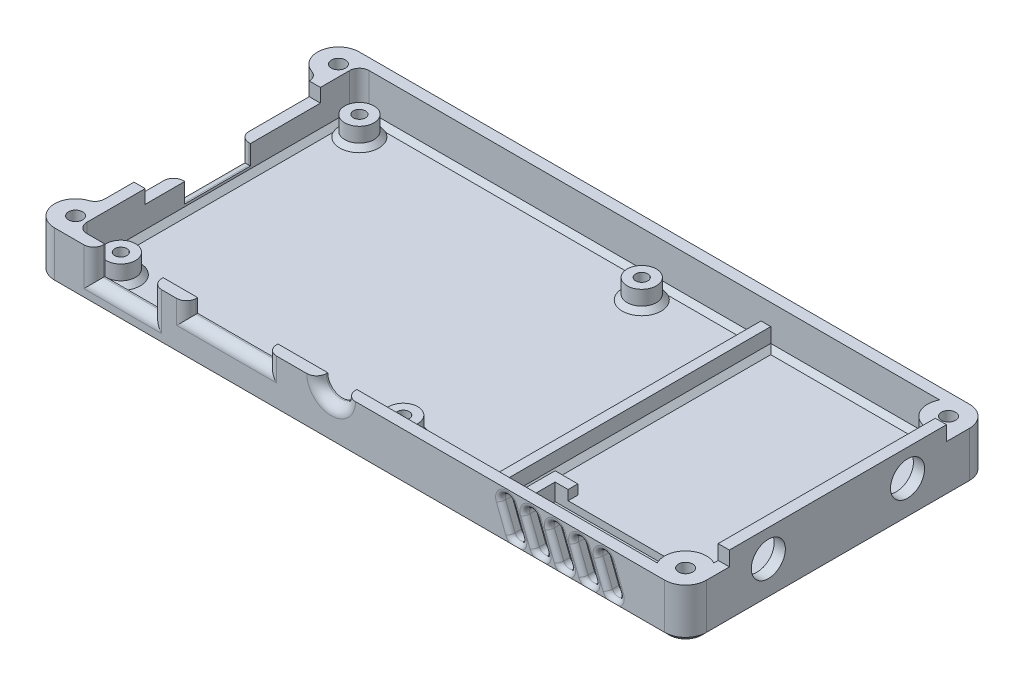
from build123d import *

# Parameters (mm, degrees)
SKETCH3_W                      = 129.6
SKETCH3_H                      = 62.6
SKETCH3_W_2                    = 125
SKETCH3_H_2                    = 58
BOSS_EXTRUDE1_DEPTH            = 10.3
SKETCH5_W                      = 125
SKETCH5_H                      = 58
BOSS_EXTRUDE2_DEPTH            = 2
SKETCH6_R                      = 3
BOSS_EXTRUDE3_DEPTH            = 4
F_2_5_2_5_DIAMETER_HOLE1_D     = 2.5
F_2_5_2_5_DIAMETER_HOLE1_DEPTH = 8
F_2_5_2_5_DIAMETER_HOLE1_TIP   = 0.751075774
SKETCH10_W                     = 2
SKETCH10_H                     = 58
BOSS_EXTRUDE4_DEPTH            = 4
CUT_EXTRUDE1_REACH             = 100.128
SKETCH11_R                     = 3
SKETCH11_W                     = 12
SKETCH11_H                     = 5.8
SKETCH11_W_2                   = 16.5
SKETCH11_H_2                   = 2.8
CUT_EXTRUDE2_REACH             = 136.484
SKETCH12_W                     = 13.5
SKETCH12_H                     = 6.8
SKETCH12_W_2                   = 36
SKETCH12_H_2                   = 2.8
FILLET6_R                      = 2
FILLET8_R                      = 2
CHAMFER1_SIZE                  = 1
FILLET9_R                      = 2
BOSS_EXTRUDE6_DEPTH            = 10.3
F_2_9_2_9_DIAMETER_HOLE2_D     = 2.9
F_2_9_2_9_DIAMETER_HOLE1_D     = 2.9
SKETCH24_R                     = 4.3
BOSS_EXTRUDE7_DEPTH            = 8.3
F_2_9_2_9_DIAMETER_HOLE5_D     = 2.9
F_2_9_2_9_DIAMETER_HOLE4_D     = 2.9
FILLET10_R                     = 4.3
FILLET18_R                     = 2
CHAMFER3_SIZE                  = 1
FILLET19_R                     = 2
FILLET20_R                     = 4.3
CHAMFER6_SIZE                  = 1
SKETCH29_W                     = 2.3
SKETCH29_H                     = 44.6
BOSS_EXTRUDE8_DEPTH            = 3
CUT_EXTRUDE3_REACH             = 163.516
SKETCH13_R                     = 3.5
SKETCH32_W                     = 30.1
SKETCH32_H                     = 10.2
CUT_EXTRUDE4_DEPTH             = 1.5
BOSS_EXTRUDE9_DEPTH            = 2
CUT_EXTRUDE5_REACH             = 103.795
FILLET21_R                     = 1
CHAMFER7_SIZE                  = 1


# Some blends are built 0.0001 mm under size
with BuildPart() as part:
    # Sketch3 → Boss-Extrude1 (new body)
    with BuildSketch(Plane(origin=(0, 0, 0), x_dir=(1, 0, 0), z_dir=(0, 1, 0))):
        with Locations((-10.061766162, 3.105993834)):
            Rectangle(SKETCH3_W, SKETCH3_H)
        with Locations((-10.061766162, 3.105993834)):
            Rectangle(SKETCH3_W_2, SKETCH3_H_2, mode=Mode.SUBTRACT)
    extrude(amount=BOSS_EXTRUDE1_DEPTH)

    # Sketch5 → Boss-Extrude2 (add)
    with BuildSketch(Plane(origin=(0, 0, 0), x_dir=(1, 0, 0), z_dir=(0, 1, 0))):
        with Locations((-10.061766162, 3.105993834)):
            Rectangle(SKETCH5_W, SKETCH5_H)
    extrude(amount=BOSS_EXTRUDE2_DEPTH)

    # Sketch6 → Boss-Extrude3 (add)
    with BuildSketch(Plane(origin=(0, 2, 0), x_dir=(1, 0, 0), z_dir=(0, 1, 0))):
        with Locations(Location((-68.061766162, 27.605993834, 0), (0, 0, 270))):
            Circle(SKETCH6_R)
        with Locations(Location((-68.061766162, -21.394006166, 0), (0, 0, 270))):
            Circle(SKETCH6_R)
        with Locations(Location((-10.061766162, -21.394006166, 0), (0, 0, 270))):
            Circle(SKETCH6_R)
        with Locations(Location((-10.061766162, 27.605993834, 0), (0, 0, 270))):
            Circle(SKETCH6_R)
    extrude(amount=BOSS_EXTRUDE3_DEPTH)

    # Ø2.5 (2.5) Diameter Hole1
    with Locations(Plane(origin=(0, 6, 0), x_dir=(1, 0, 0), z_dir=(0, 1, 0))):
        with Locations((-68.061766162, 27.605993834), (-10.061766162, 27.605993834), (-10.061766162, -21.394006166), (-68.061766162, -21.394006166)):
            Hole(F_2_5_2_5_DIAMETER_HOLE1_D / 2, depth=F_2_5_2_5_DIAMETER_HOLE1_DEPTH)
            with Locations((0, 0, -(F_2_5_2_5_DIAMETER_HOLE1_DEPTH + F_2_5_2_5_DIAMETER_HOLE1_TIP / 2))):  # 118° drill point
                Cone(0, F_2_5_2_5_DIAMETER_HOLE1_D / 2, F_2_5_2_5_DIAMETER_HOLE1_TIP, mode=Mode.SUBTRACT)

    # Sketch10 → Boss-Extrude4 (add)
    with BuildSketch(Plane(origin=(0, 2, 0), x_dir=(1, 0, 0), z_dir=(0, 1, 0))):
        with Locations((10.938233838, 3.105993834)):
            Rectangle(SKETCH10_W, SKETCH10_H)
    extrude(amount=BOSS_EXTRUDE4_DEPTH)

    # Sketch11 → Cut-Extrude1 (cut, up to next)
    with BuildSketch(Plane.XY.offset(28.194006166), mode=Mode.PRIVATE) as cut_extrude1_sk1:
        with Locations((-18.061766162, 10.3)):
            Circle(SKETCH11_R)
    cut_extrude1_tool1 = extrude(cut_extrude1_sk1.sketch, amount=-CUT_EXTRUDE1_REACH, mode=Mode.PRIVATE) & part.part
    # Sketch11 → Cut-Extrude1 (cut, up to next)
    with BuildSketch(Plane.XY.offset(28.194006166), mode=Mode.PRIVATE) as cut_extrude1_sk2:
        with Locations((-60.861766162, 7.4)):
            Rectangle(SKETCH11_W, SKETCH11_H)
    cut_extrude1_tool2 = extrude(cut_extrude1_sk2.sketch, amount=-CUT_EXTRUDE1_REACH, mode=Mode.PRIVATE) & part.part
    # Sketch11 → Cut-Extrude1 (cut, up to next)
    with BuildSketch(Plane.XY.offset(28.194006166), mode=Mode.PRIVATE) as cut_extrude1_sk3:
        with Locations((-39.527982648, 8.9)):
            Rectangle(SKETCH11_W_2, SKETCH11_H_2)
    cut_extrude1_tool3 = extrude(cut_extrude1_sk3.sketch, amount=-CUT_EXTRUDE1_REACH, mode=Mode.PRIVATE) & part.part
    add(cut_extrude1_tool1.solids().sort_by_distance((-18.061766, 10.3, 28.194006))[0], mode=Mode.SUBTRACT)
    add(cut_extrude1_tool2.solids().sort_by_distance((-60.861766, 7.4, 28.194006))[0], mode=Mode.SUBTRACT)
    add(cut_extrude1_tool3.solids().sort_by_distance((-39.527983, 8.9, 28.194006))[0], mode=Mode.SUBTRACT)

    # Sketch12 → Cut-Extrude2 (cut, up to next)
    with BuildSketch(Plane.ZY.offset(74.861766162), mode=Mode.PRIVATE) as cut_extrude2_sk1:
        with Locations((-2.982922372, 6.9)):
            Rectangle(SKETCH12_W, SKETCH12_H)
    cut_extrude2_tool1 = extrude(cut_extrude2_sk1.sketch, amount=-CUT_EXTRUDE2_REACH, mode=Mode.PRIVATE) & part.part
    # Sketch12 → Cut-Extrude2 (cut, up to next)
    with BuildSketch(Plane.ZY.offset(74.861766162), mode=Mode.PRIVATE) as cut_extrude2_sk2:
        with Locations((-6.105993834, 8.9)):
            Rectangle(SKETCH12_W_2, SKETCH12_H_2)
    cut_extrude2_tool2 = extrude(cut_extrude2_sk2.sketch, amount=-CUT_EXTRUDE2_REACH, mode=Mode.PRIVATE) & part.part
    add(cut_extrude2_tool1.solids().sort_by_distance((-74.861766, 6.9, -2.982922))[0], mode=Mode.SUBTRACT)
    add(cut_extrude2_tool2.solids().sort_by_distance((-74.861766, 8.9, -6.105994))[0], mode=Mode.SUBTRACT)

    # Fillet6
    fillet6_edges = [part.edges().sort_by_distance(p)[0] for p in [
        (52.438233838, 6.15, -32.105993834),
    ]]
    fillet(fillet6_edges, radius=FILLET6_R)

    # Fillet8
    fillet8_edges = [part.edges().sort_by_distance(p)[0] for p in [
        (-72.561766162, 6.15, -32.105993834),
        (-72.561766162, 6.15, 25.894006166),
    ]]
    fillet(fillet8_edges, radius=FILLET8_R)

    # Chamfer1
    chamfer1_edges = [part.edges().sort_by_distance(p)[0] for p in [
        (-68.061766162, 2, -30.605993834),
        (-68.061766162, 2, 18.394006166),
        (-10.061766162, 2, 18.394006166),
        (-10.061766162, 2, -30.605993834),
    ]]
    chamfer(chamfer1_edges, length=CHAMFER1_SIZE)

    # Fillet9
    fillet9_edges = [part.edges().sort_by_distance(p)[0] for p in [
        (-60.861766162, 4.5, 28.194006166),
        (-54.861766162, 7.4, 28.194006166),
        (-47.777982648, 8.9, 28.194006166),
        (-39.527982648, 7.5, 28.194006166),
        (-31.277982648, 8.9, 28.194006166),
        (-18.061766162, 7.3, 28.194006166),
        (-74.861766162, 5.5, -9.732922372),
        (-74.861766162, 3.5, -2.982922372),
        (-74.861766162, 5.5, 3.767077628),
    ]]
    fillet(fillet9_edges, radius=FILLET9_R)

    # Sketch17 → Boss-Extrude6 (add)
    with BuildSketch(Plane(origin=(0, 0, 0), x_dir=(1, 0, 0), z_dir=(0, 1, 0))):
        with BuildLine():
            Line((-74.861766162, 34.405993834), (-74.861766162, 25.805993834))
            ThreePointArc((-74.861766162, 25.805993834), (-79.161766162, 30.105993834), (-74.861766162, 34.405993834))
        make_face()
        with BuildLine():
            Line((-74.861766162, -19.594006166), (-74.861766162, -28.194006166))
            ThreePointArc((-74.861766162, -28.194006166), (-79.161766162, -23.894006166), (-74.861766162, -19.594006166))
        make_face()
    extrude(amount=BOSS_EXTRUDE6_DEPTH)

    # Ø2.9 (2.9) Diameter Hole2 (through all)
    with Locations(Plane(origin=(0, 10.3, 0), x_dir=(1, 0, 0), z_dir=(0, 1, 0))):
        with Locations((-74.861766162, 30.105993834)):
            Hole(F_2_9_2_9_DIAMETER_HOLE2_D / 2)

    # Ø2.9 (2.9) Diameter Hole1 (through all)
    with Locations(Plane(origin=(0, 10.3, 0), x_dir=(1, 0, 0), z_dir=(0, 1, 0))):
        with Locations((-74.861766162, -23.894006166)):
            Hole(F_2_9_2_9_DIAMETER_HOLE1_D / 2)

    # Sketch24 → Boss-Extrude7 (add)
    with BuildSketch(Plane(origin=(0, 2, 0), x_dir=(1, 0, 0), z_dir=(0, 1, 0))):
        with Locations((50.438233838, -23.894006166)):
            Circle(SKETCH24_R)
        with Locations((50.438233838, 30.105993834)):
            Circle(SKETCH24_R)
    extrude(amount=BOSS_EXTRUDE7_DEPTH)

    # Ø2.9 (2.9) Diameter Hole5 (through all)
    with Locations(Plane(origin=(0, 10.3, 0), x_dir=(1, 0, 0), z_dir=(0, 1, 0))):
        with Locations((50.438233838, -23.894006166)):
            Hole(F_2_9_2_9_DIAMETER_HOLE5_D / 2)

    # Ø2.9 (2.9) Diameter Hole4 (through all)
    with Locations(Plane(origin=(0, 10.3, 0), x_dir=(1, 0, 0), z_dir=(0, 1, 0))):
        with Locations((50.438233838, 30.105993834)):
            Hole(F_2_9_2_9_DIAMETER_HOLE4_D / 2)

    # Fillet10
    fillet10_edges = [part.edges().sort_by_distance(p)[0] for p in [
        (54.738233838, 5.15, -34.405993834),
    ]]
    fillet(fillet10_edges, radius=FILLET10_R - 0.0001)  # a hair under: the kernel refuses the full size

    # Fillet18
    fillet18_edges = [part.edges().sort_by_distance(p)[0] for p in [
        (-74.861766162, 5.15, -25.805993834),
        (-74.861766162, 5.15, 19.594006166),
    ]]
    fillet(fillet18_edges, radius=FILLET18_R)

    # Chamfer3
    chamfer3_edges = [part.edges().sort_by_distance(p)[0] for p in [
        (-79.105793795, 0, -30.797535193),
        (-12.211716162, 0, -34.405993834),
        (53.478822286, 0, -33.146582283),
        (-79.105793795, 0, 24.585547524),
        (-74.861766162, 0, -3.105993834),
        (-75.2385223, 0, 19.088261462),
        (-75.2385223, 0, -25.300249131),
        (54.738233838, 0, -0.956043834),
        (-10.061766162, 0, 28.194006166),
    ]]
    chamfer(chamfer3_edges, length=CHAMFER3_SIZE)

    # Fillet19
    fillet19_edges = [part.edges().sort_by_distance(p)[0] for p in [
        (-66.861766162, 6.4, 28.194006166),
    ]]
    fillet(fillet19_edges, radius=FILLET19_R)

    # Fillet20
    # the kernel refuses this fillet: 4.3 mm, written as the material it takes off along each edge
    with BuildSketch(Plane(origin=(54.738233838, -9.75, 28.194006166), x_dir=(-1, 0, 0), z_dir=(0, 1, 0))) as fillet20_piece_1:
        with BuildLine():
            CenterArc((FILLET20_R, -FILLET20_R), FILLET20_R, 90, 90)
            Line((0, -FILLET20_R), (0, 0))
            Line((0, 0), (FILLET20_R, 0))
        make_face()
    extrude(amount=30.8, mode=Mode.SUBTRACT)

    # Chamfer5
    # the kernel refuses this chamfer: 1 mm, written as the material it adds along each edge
    with BuildSketch(Plane(origin=(-72.561766162, 2, 23.894006166), x_dir=(-0.027495876610568366, 0.9996219169112972, 0), z_dir=(0, 0, -1))) as chamfer5_piece_1:
        with BuildLine():
            Line((1.028673195, 0), (-0.056547155, 1.027117794))
            Line((-0.056547155, 1.027117794), (-0.076539593, 1.026567876))
            ThreePointArc((-0.076539593, 1.026567876), (-0.034129227, 0.51339783), (-0.019992438, -0.000549918))
            Line((-0.019992438, -0.000549918), (0.000549918, -0.019992438))
            ThreePointArc((0.000549918, -0.019992438), (0.514497665, -0.00585565), (1.029223113, -0.019992438))
            Line((1.029223113, -0.019992438), (1.028673195, 0))
        make_face()
    extrude(amount=54)
    with BuildSketch(Plane(origin=(-70.561766162, 2, 23.894006166), x_dir=(0, 0, 1), z_dir=(1, 0, 0))) as chamfer5_piece_2:
        with BuildLine():
            Line((0.971715729, 0.028284271), (2.028284271, -1.028284271))
            Line((2.028284271, -1.028284271), (2.048284271, -1.028284271))
            ThreePointArc((2.048284271, -1.028284271), (2.02, -0.514142136), (2.02, 0))
            Line((2.02, 0), (2, 0.02))
            ThreePointArc((2, 0.02), (1.485857864, 0.02), (0.971715729, 0.048284271))
            Line((0.971715729, 0.048284271), (0.971715729, 0.028284271))
        make_face()
    revolve(axis=Axis((-70.561766162, 2, 23.894006166), (0, -1, 0)), revolution_arc=90)
    with BuildSketch(Plane(origin=(-70.561766162, 2, -30.105993834), x_dir=(0, 0, -1), z_dir=(1, 0, 0))) as chamfer5_piece_3:
        with BuildLine():
            Line((2.028284271, 1.028284271), (0.971715729, -0.028284271))
            Line((0.971715729, -0.028284271), (0.971715729, -0.048284271))
            ThreePointArc((0.971715729, -0.048284271), (1.485857864, -0.02), (2, -0.02))
            Line((2, -0.02), (2.02, 0))
            ThreePointArc((2.02, 0), (2.02, 0.514142136), (2.048284271, 1.028284271))
            Line((2.048284271, 1.028284271), (2.028284271, 1.028284271))
        make_face()
    revolve(axis=Axis((-70.561766162, 2, -30.105993834), (0, 1, 0)), revolution_arc=90)
    with BuildSketch(Plane(origin=(9.938233838, 2, 25.894006166), x_dir=(0, 0.9996219169112968, 0.027495876610585623), z_dir=(-1, 0, 0)), Plane(origin=(-70.561766162, 2, -32.105993834), x_dir=(0, 0.9996219169112968, -0.027495876610589075), z_dir=(1, 0, 0))) as chamfer5_piece_4:
        with BuildLine():
            Line((1.028673195, 0), (-0.056547155, 1.027117794))
            Line((-0.056547155, 1.027117794), (-0.076539593, 1.026567876))
            ThreePointArc((-0.076539593, 1.026567876), (-0.034129227, 0.51339783), (-0.019992438, -0.000549918))
            Line((-0.019992438, -0.000549918), (0.000549918, -0.019992438))
            ThreePointArc((0.000549918, -0.019992438), (0.514497665, -0.00585565), (1.029223113, -0.019992438))
            Line((1.029223113, -0.019992438), (1.028673195, 0))
        make_face()
    extrude(amount=80.5)
    with BuildSketch(Plane(origin=(9.938233838, 2, 25.894006166), x_dir=(0.027495876610585623, 0.9996219169112968, 0), z_dir=(0, 0, -1)), Plane(origin=(11.938233838, 2, -32.105993834), x_dir=(-0.027495876610585623, 0.9996219169112968, 0), z_dir=(0, 0, 1))) as chamfer5_piece_5:
        with BuildLine():
            Line((1.028673195, 0), (-0.056547155, -1.027117794))
            Line((-0.056547155, -1.027117794), (-0.076539593, -1.026567876))
            ThreePointArc((-0.076539593, -1.026567876), (-0.034129227, -0.51339783), (-0.019992438, 0.000549918))
            Line((-0.019992438, 0.000549918), (0.000549918, 0.019992438))
            ThreePointArc((0.000549918, 0.019992438), (0.514497665, 0.00585565), (1.029223113, 0.019992438))
            Line((1.029223113, 0.019992438), (1.028673195, 0))
        make_face()
    extrude(amount=58)
    with BuildSketch(Plane(origin=(11.938233838, 2, -32.105993834), x_dir=(0, 0.9996219169112968, -0.027495876610589075), z_dir=(1, 0, 0))) as chamfer5_piece_6_section:
        with BuildLine():
            Line((1.028673195, 0), (-0.056547155, 1.027117794))
            Line((-0.056547155, 1.027117794), (-0.076539593, 1.026567876))
            ThreePointArc((-0.076539593, 1.026567876), (-0.034129227, 0.51339783), (-0.019992438, -0.000549918))
            Line((-0.019992438, -0.000549918), (0.000549918, -0.019992438))
            ThreePointArc((0.000549918, -0.019992438), (0.514497665, -0.00585565), (1.029223113, -0.019992438))
            Line((1.029223113, -0.019992438), (1.028673195, 0))
        make_face()
    chamfer5_piece_6 = extrude(amount=37.265109726, mode=Mode.PRIVATE)
    chamfer5_piece_6 = chamfer5_piece_6 - Plane(origin=(50.438233838, 2.330190731, -30.105993834), x_dir=(1, 0, 0), z_dir=(0, -1, 0)) * Cylinder(4.3, 79, mode=Mode.PRIVATE)
    add(chamfer5_piece_6)
    with BuildSketch(Plane(origin=(9.938233838, 2, 28.465689154), x_dir=(0.027495876610585623, 0.9996219169112968, 0), z_dir=(0, 0, -1))) as chamfer5_piece_7a_section:
        with BuildLine():
            Line((1.028673195, 0), (-0.056547155, -1.027117794))
            Line((-0.056547155, -1.027117794), (-0.076539593, -1.026567876))
            ThreePointArc((-0.076539593, -1.026567876), (-0.034129227, -0.51339783), (-0.019992438, 0.000549918))
            Line((-0.019992438, 0.000549918), (0.000549918, 0.019992438))
            ThreePointArc((0.000549918, 0.019992438), (0.514497665, 0.00585565), (1.029223113, 0.019992438))
            Line((1.029223113, 0.019992438), (1.028673195, 0))
        make_face()
    chamfer5_piece_7a = extrude(amount=60.571682988, mode=Mode.PRIVATE)
    chamfer5_piece_7a = split(chamfer5_piece_7a, bisect_by=Plane(origin=(9.608440211, 2.329793627, 25.894006166), z_dir=(0, 0, 1)), keep=Keep.TOP, mode=Mode.PRIVATE)
    with BuildSketch(Plane(origin=(12.509916826, 2, 25.894006166), x_dir=(0, 0.9996219169112968, 0.027495876610585623), z_dir=(-1, 0, 0))) as chamfer5_piece_7b_section:
        with BuildLine():
            Line((1.028673195, 0), (-0.056547155, 1.027117794))
            Line((-0.056547155, 1.027117794), (-0.076539593, 1.026567876))
            ThreePointArc((-0.076539593, 1.026567876), (-0.034129227, 0.51339783), (-0.019992438, -0.000549918))
            Line((-0.019992438, -0.000549918), (0.000549918, -0.019992438))
            ThreePointArc((0.000549918, -0.019992438), (0.514497665, -0.00585565), (1.029223113, -0.019992438))
            Line((1.029223113, -0.019992438), (1.028673195, 0))
        make_face()
    chamfer5_piece_7b = extrude(amount=83.071682988, mode=Mode.PRIVATE)
    chamfer5_piece_7b = split(chamfer5_piece_7b, bisect_by=Plane(origin=(9.938233838, 2.329793627, 25.564212539), z_dir=(1, 0, 0)), keep=Keep.TOP, mode=Mode.PRIVATE)
    chamfer5_piece_7 = chamfer5_piece_7a & chamfer5_piece_7b
    add(chamfer5_piece_7)
    with BuildSketch(Plane(origin=(-70.561766162, 2, -32.105993834), x_dir=(0, 0.9996219169112968, -0.027495876610589075), z_dir=(1, 0, 0))) as chamfer5_piece_8a_section:
        with BuildLine():
            Line((1.028673195, 0), (-0.056547155, 1.027117794))
            Line((-0.056547155, 1.027117794), (-0.076539593, 1.026567876))
            ThreePointArc((-0.076539593, 1.026567876), (-0.034129227, 0.51339783), (-0.019992438, -0.000549918))
            Line((-0.019992438, -0.000549918), (0.000549918, -0.019992438))
            ThreePointArc((0.000549918, -0.019992438), (0.514497665, -0.00585565), (1.029223113, -0.019992438))
            Line((1.029223113, -0.019992438), (1.028673195, 0))
        make_face()
    chamfer5_piece_8a = extrude(amount=83.071682988, mode=Mode.PRIVATE)
    chamfer5_piece_8a = split(chamfer5_piece_8a, bisect_by=Plane(origin=(9.938233838, 2.329793627, -31.776200208), z_dir=(1, 0, 0)), keep=Keep.TOP, mode=Mode.PRIVATE)
    with BuildSketch(Plane(origin=(9.938233838, 2, 25.894006166), x_dir=(0.027495876610585623, 0.9996219169112968, 0), z_dir=(0, 0, -1))) as chamfer5_piece_8b_section:
        with BuildLine():
            Line((1.028673195, 0), (-0.056547155, -1.027117794))
            Line((-0.056547155, -1.027117794), (-0.076539593, -1.026567876))
            ThreePointArc((-0.076539593, -1.026567876), (-0.034129227, -0.51339783), (-0.019992438, 0.000549918))
            Line((-0.019992438, 0.000549918), (0.000549918, 0.019992438))
            ThreePointArc((0.000549918, 0.019992438), (0.514497665, 0.00585565), (1.029223113, 0.019992438))
            Line((1.029223113, 0.019992438), (1.028673195, 0))
        make_face()
    chamfer5_piece_8b = extrude(amount=60.571682988, mode=Mode.PRIVATE)
    chamfer5_piece_8b = split(chamfer5_piece_8b, bisect_by=Plane(origin=(9.608440211, 2.329793627, -32.105993834), z_dir=(0, 0, -1)), keep=Keep.TOP, mode=Mode.PRIVATE)
    chamfer5_piece_8 = chamfer5_piece_8a & chamfer5_piece_8b
    add(chamfer5_piece_8)
    with BuildSketch(Plane(origin=(9.36655085, 2, -32.105993834), x_dir=(0, 0.9996219169112968, -0.027495876610589075), z_dir=(1, 0, 0))) as chamfer5_piece_9a_section:
        with BuildLine():
            Line((1.028673195, 0), (-0.056547155, 1.027117794))
            Line((-0.056547155, 1.027117794), (-0.076539593, 1.026567876))
            ThreePointArc((-0.076539593, 1.026567876), (-0.034129227, 0.51339783), (-0.019992438, -0.000549918))
            Line((-0.019992438, -0.000549918), (0.000549918, -0.019992438))
            ThreePointArc((0.000549918, -0.019992438), (0.514497665, -0.00585565), (1.029223113, -0.019992438))
            Line((1.029223113, -0.019992438), (1.028673195, 0))
        make_face()
    chamfer5_piece_9a = extrude(amount=39.836792714, mode=Mode.PRIVATE)
    chamfer5_piece_9a = split(chamfer5_piece_9a, bisect_by=Plane(origin=(11.938233838, 2.329793627, -31.776200208), z_dir=(-1, 0, 0)), keep=Keep.TOP, mode=Mode.PRIVATE)
    with BuildSketch(Plane(origin=(11.938233838, 2, -34.677676822), x_dir=(-0.027495876610585623, 0.9996219169112968, 0), z_dir=(0, 0, 1))) as chamfer5_piece_9b_section:
        with BuildLine():
            Line((1.028673195, 0), (-0.056547155, -1.027117794))
            Line((-0.056547155, -1.027117794), (-0.076539593, -1.026567876))
            ThreePointArc((-0.076539593, -1.026567876), (-0.034129227, -0.51339783), (-0.019992438, 0.000549918))
            Line((-0.019992438, 0.000549918), (0.000549918, 0.019992438))
            ThreePointArc((0.000549918, 0.019992438), (0.514497665, 0.00585565), (1.029223113, 0.019992438))
            Line((1.029223113, 0.019992438), (1.028673195, 0))
        make_face()
    chamfer5_piece_9b = extrude(amount=60.571682988, mode=Mode.PRIVATE)
    chamfer5_piece_9b = split(chamfer5_piece_9b, bisect_by=Plane(origin=(12.268027465, 2.329793627, -32.105993834), z_dir=(0, 0, -1)), keep=Keep.TOP, mode=Mode.PRIVATE)
    chamfer5_piece_9 = chamfer5_piece_9a & chamfer5_piece_9b
    add(chamfer5_piece_9)

    # Chamfer6
    chamfer6_edges = [part.edges().sort_by_distance(p)[0] for p in [
        (52.438233838, 2, -3.105993834),
    ]]
    chamfer(chamfer6_edges, length=CHAMFER6_SIZE)

    # Sketch29 → Boss-Extrude8 (add)
    with BuildSketch(Plane(origin=(0, 10.3, 0), x_dir=(1, 0, 0), z_dir=(0, 1, 0))):
        with Locations((53.588233838, 3.105993834)):
            Rectangle(SKETCH29_W, SKETCH29_H)
    extrude(amount=BOSS_EXTRUDE8_DEPTH)

    # Sketch13 → Cut-Extrude3 (cut, up to next)
    with BuildSketch(Plane(origin=(54.738233838, 0, -61.144227672), x_dir=(0, 0, -1), z_dir=(1, 0, 0)), mode=Mode.PRIVATE) as cut_extrude3_sk1:
        with Locations((-72.338233838, 7.722271929)):
            Circle(SKETCH13_R)
    cut_extrude3_tool1 = extrude(cut_extrude3_sk1.sketch, amount=-CUT_EXTRUDE3_REACH, mode=Mode.PRIVATE) & part.part
    # Sketch13 → Cut-Extrude3 (cut, up to next)
    with BuildSketch(Plane(origin=(54.738233838, 0, -61.144227672), x_dir=(0, 0, -1), z_dir=(1, 0, 0)), mode=Mode.PRIVATE) as cut_extrude3_sk2:
        with Locations((-43.738233838, 7.722271929)):
            Circle(SKETCH13_R)
    cut_extrude3_tool2 = extrude(cut_extrude3_sk2.sketch, amount=-CUT_EXTRUDE3_REACH, mode=Mode.PRIVATE) & part.part
    add(cut_extrude3_tool1.solids().sort_by_distance((54.738234, 7.722272, 11.194006))[0], mode=Mode.SUBTRACT)
    add(cut_extrude3_tool2.solids().sort_by_distance((54.738234, 7.722272, -17.405994))[0], mode=Mode.SUBTRACT)

    # Sketch32 → Cut-Extrude4 (cut)
    with BuildSketch(Plane(origin=(0, 2, 0), x_dir=(1, 0, 0), z_dir=(0, 1, 0))):
        with Locations((30.488233838, -20.794006166)):
            Rectangle(SKETCH32_W, SKETCH32_H)
    extrude(amount=-CUT_EXTRUDE4_DEPTH, mode=Mode.SUBTRACT)

    # Sketch33 → Boss-Extrude9 (add)
    with BuildSketch(Plane(origin=(0, 2, 0), x_dir=(1, 0, 0), z_dir=(0, 1, 0))):
        Polygon((15.438233838, -15.694006166), (15.438233838, -25.894006166), (13.438233838, -25.894006166), (13.438233838, -13.694006166), (18.108333222, -13.694006166), (18.108333222, -15.694006166), align=None)
        Polygon((47.538233838, -13.694006166), (47.538233838, -20.882174736), (45.538233838, -20.882174736), (45.538233838, -15.694006166), (42.868134454, -15.694006166), (42.868134454, -13.694006166), align=None)
    extrude(amount=BOSS_EXTRUDE9_DEPTH)

    # Sketch34 → Cut-Extrude5 (cut, up to next)
    with BuildSketch(Plane.XY.offset(28.194006166), mode=Mode.PRIVATE) as cut_extrude5_sk1:
        with BuildLine():
            Line((19.140183986, 8.196301764), (21.05650073, 3.254871795))
            ThreePointArc((21.05650073, 3.254871795), (20.34303063, 1.637478703), (18.725637537, 2.350948803))
            Line((18.725637537, 2.350948803), (16.809320793, 7.292378772))
            ThreePointArc((16.809320793, 7.292378772), (17.522790894, 8.909771864), (19.140183986, 8.196301764))
        make_face()
    cut_extrude5_tool1 = extrude(cut_extrude5_sk1.sketch, amount=-CUT_EXTRUDE5_REACH, mode=Mode.PRIVATE) & part.part
    # Sketch34 → Cut-Extrude5 (cut, up to next)
    with BuildSketch(Plane.XY.offset(28.194006166), mode=Mode.PRIVATE) as cut_extrude5_sk2:
        with BuildLine():
            Line((24.140183986, 8.196301764), (26.05650073, 3.254871795))
            ThreePointArc((26.05650073, 3.254871795), (25.34303063, 1.637478703), (23.725637537, 2.350948803))
            Line((23.725637537, 2.350948803), (21.809320793, 7.292378772))
            ThreePointArc((21.809320793, 7.292378772), (22.522790894, 8.909771864), (24.140183986, 8.196301764))
        make_face()
    cut_extrude5_tool2 = extrude(cut_extrude5_sk2.sketch, amount=-CUT_EXTRUDE5_REACH, mode=Mode.PRIVATE) & part.part
    # Sketch34 → Cut-Extrude5 (cut, up to next)
    with BuildSketch(Plane.XY.offset(28.194006166), mode=Mode.PRIVATE) as cut_extrude5_sk3:
        with BuildLine():
            Line((29.140183986, 8.196301764), (31.05650073, 3.254871795))
            ThreePointArc((31.05650073, 3.254871795), (30.34303063, 1.637478703), (28.725637537, 2.350948803))
            Line((28.725637537, 2.350948803), (26.809320793, 7.292378772))
            ThreePointArc((26.809320793, 7.292378772), (27.522790894, 8.909771864), (29.140183986, 8.196301764))
        make_face()
    cut_extrude5_tool3 = extrude(cut_extrude5_sk3.sketch, amount=-CUT_EXTRUDE5_REACH, mode=Mode.PRIVATE) & part.part
    # Sketch34 → Cut-Extrude5 (cut, up to next)
    with BuildSketch(Plane.XY.offset(28.194006166), mode=Mode.PRIVATE) as cut_extrude5_sk4:
        with BuildLine():
            Line((34.140183986, 8.196301764), (36.05650073, 3.254871795))
            ThreePointArc((36.05650073, 3.254871795), (35.34303063, 1.637478703), (33.725637537, 2.350948803))
            Line((33.725637537, 2.350948803), (31.809320793, 7.292378772))
            ThreePointArc((31.809320793, 7.292378772), (32.522790894, 8.909771864), (34.140183986, 8.196301764))
        make_face()
    cut_extrude5_tool4 = extrude(cut_extrude5_sk4.sketch, amount=-CUT_EXTRUDE5_REACH, mode=Mode.PRIVATE) & part.part
    # Sketch34 → Cut-Extrude5 (cut, up to next)
    with BuildSketch(Plane.XY.offset(28.194006166), mode=Mode.PRIVATE) as cut_extrude5_sk5:
        with BuildLine():
            Line((39.140183986, 8.196301764), (41.05650073, 3.254871795))
            ThreePointArc((41.05650073, 3.254871795), (40.34303063, 1.637478703), (38.725637537, 2.350948803))
            Line((38.725637537, 2.350948803), (36.809320793, 7.292378772))
            ThreePointArc((36.809320793, 7.292378772), (37.522790894, 8.909771864), (39.140183986, 8.196301764))
        make_face()
    cut_extrude5_tool5 = extrude(cut_extrude5_sk5.sketch, amount=-CUT_EXTRUDE5_REACH, mode=Mode.PRIVATE) & part.part
    add(cut_extrude5_tool1.solids().sort_by_distance((18.932911, 5.273625, 28.194006))[0], mode=Mode.SUBTRACT)
    add(cut_extrude5_tool2.solids().sort_by_distance((23.932911, 5.273625, 28.194006))[0], mode=Mode.SUBTRACT)
    add(cut_extrude5_tool3.solids().sort_by_distance((28.932911, 5.273625, 28.194006))[0], mode=Mode.SUBTRACT)
    add(cut_extrude5_tool4.solids().sort_by_distance((33.932911, 5.273625, 28.194006))[0], mode=Mode.SUBTRACT)
    add(cut_extrude5_tool5.solids().sort_by_distance((38.932911, 5.273625, 28.194006))[0], mode=Mode.SUBTRACT)

    # Fillet21
    # the kernel refuses this fillet: 1 mm, written as the material it takes off along each edge
    with BuildSketch(Plane(origin=(17.97475239, 7.744340268, 28.194006166), x_dir=(-0.9323452771444899, -0.3615691969545585, 0), z_dir=(0.3615691969545585, -0.9323452771444899, 0))) as fillet21_piece_1:
        with BuildLine():
            CenterArc((1.25 + FILLET21_R, FILLET21_R), FILLET21_R, 180, 90)
            Line((1.25 + FILLET21_R, 0), (1.25, 0))
            Line((1.25, 0), (1.25, FILLET21_R))
        make_face()
    revolve(axis=Axis((17.97475239, 7.744340268, 28.194006166), (0, 0, -1)), revolution_arc=180, mode=Mode.SUBTRACT)
    with BuildSketch(Plane(origin=(18.725637537, 2.350948803, 28.194006166), x_dir=(0, 0, -1), z_dir=(-0.36156919695456985, 0.9323452771444856, 0)), Plane(origin=(19.140183986, 8.196301764, 28.194006166), x_dir=(0, 0, -1), z_dir=(0.3615691969545619, -0.9323452771444886, 0)), Plane(origin=(23.725637537, 2.350948803, 28.194006166), x_dir=(0, 0, -1), z_dir=(-0.3615691969545605, 0.9323452771444891, 0)), Plane(origin=(24.140183986, 8.196301764, 28.194006166), x_dir=(0, 0, -1), z_dir=(0.3615691969545605, -0.9323452771444891, 0)), Plane(origin=(28.725637537, 2.350948803, 28.194006166), x_dir=(0, 0, -1), z_dir=(-0.3615691969545601, 0.9323452771444893, 0)), Plane(origin=(29.140183986, 8.196301764, 28.194006166), x_dir=(0, 0, -1), z_dir=(0.3615691969545628, -0.9323452771444882, 0)), Plane(origin=(33.725637537, 2.350948803, 28.194006166), x_dir=(0, 0, -1), z_dir=(-0.3615691969545628, 0.9323452771444882, 0)), Plane(origin=(34.140183986, 8.196301764, 28.194006166), x_dir=(0, 0, -1), z_dir=(0.3615691969545605, -0.9323452771444891, 0)), Plane(origin=(38.725637537, 2.350948803, 28.194006166), x_dir=(0, 0, -1), z_dir=(-0.3615691969545605, 0.9323452771444891, 0)), Plane(origin=(39.140183986, 8.196301764, 28.194006166), x_dir=(0, 0, -1), z_dir=(0.36156919695455964, -0.9323452771444896, 0))) as fillet21_piece_2:
        with BuildLine():
            CenterArc((FILLET21_R, FILLET21_R), FILLET21_R, 180, 90)
            Line((0, FILLET21_R), (0, 0))
            Line((0, 0), (FILLET21_R, 0))
        make_face()
    extrude(amount=5.3, mode=Mode.SUBTRACT)
    with BuildSketch(Plane(origin=(19.891069134, 2.802910299, 28.194006166), x_dir=(0.9323452771444968, 0.36156919695454104, 0), z_dir=(-0.36156919695454104, 0.9323452771444968, 0))) as fillet21_piece_3:
        with BuildLine():
            CenterArc((1.25 + FILLET21_R, FILLET21_R), FILLET21_R, 180, 90)
            Line((1.25 + FILLET21_R, 0), (1.25, 0))
            Line((1.25, 0), (1.25, FILLET21_R))
        make_face()
    revolve(axis=Axis((19.891069134, 2.802910299, 28.194006166), (0, 0, -1)), revolution_arc=180, mode=Mode.SUBTRACT)
    with BuildSketch(Plane(origin=(22.97475239, 7.744340268, 28.194006166), x_dir=(-0.9323452771444899, -0.3615691969545585, 0), z_dir=(0.3615691969545585, -0.9323452771444899, 0))) as fillet21_piece_4:
        with BuildLine():
            CenterArc((1.25 + FILLET21_R, FILLET21_R), FILLET21_R, 180, 90)
            Line((1.25 + FILLET21_R, 0), (1.25, 0))
            Line((1.25, 0), (1.25, FILLET21_R))
        make_face()
    revolve(axis=Axis((22.97475239, 7.744340268, 28.194006166), (0, 0, -1)), revolution_arc=180, mode=Mode.SUBTRACT)
    with BuildSketch(Plane(origin=(24.891069134, 2.802910299, 28.194006166), x_dir=(0.9323452771444884, 0.3615691969545626, 0), z_dir=(-0.3615691969545626, 0.9323452771444884, 0))) as fillet21_piece_5:
        with BuildLine():
            CenterArc((1.25 + FILLET21_R, FILLET21_R), FILLET21_R, 180, 90)
            Line((1.25 + FILLET21_R, 0), (1.25, 0))
            Line((1.25, 0), (1.25, FILLET21_R))
        make_face()
    revolve(axis=Axis((24.891069134, 2.802910299, 28.194006166), (0, 0, -1)), revolution_arc=180, mode=Mode.SUBTRACT)
    with BuildSketch(Plane(origin=(27.97475239, 7.744340268, 28.194006166), x_dir=(-0.9323452771444901, -0.36156919695455786, 0), z_dir=(0.36156919695455786, -0.9323452771444901, 0))) as fillet21_piece_6:
        with BuildLine():
            CenterArc((1.25 + FILLET21_R, FILLET21_R), FILLET21_R, 180, 90)
            Line((1.25 + FILLET21_R, 0), (1.25, 0))
            Line((1.25, 0), (1.25, FILLET21_R))
        make_face()
    revolve(axis=Axis((27.97475239, 7.744340268, 28.194006166), (0, 0, -1)), revolution_arc=180, mode=Mode.SUBTRACT)
    with BuildSketch(Plane(origin=(29.891069134, 2.802910299, 28.194006166), x_dir=(0.9323452771444861, 0.3615691969545684, 0), z_dir=(-0.3615691969545684, 0.9323452771444861, 0))) as fillet21_piece_7:
        with BuildLine():
            CenterArc((1.25 + FILLET21_R, FILLET21_R), FILLET21_R, 180, 90)
            Line((1.25 + FILLET21_R, 0), (1.25, 0))
            Line((1.25, 0), (1.25, FILLET21_R))
        make_face()
    revolve(axis=Axis((29.891069134, 2.802910299, 28.194006166), (0, 0, -1)), revolution_arc=180, mode=Mode.SUBTRACT)
    with BuildSketch(Plane(origin=(32.97475239, 7.744340268, 28.194006166), x_dir=(-0.9323452771444872, -0.36156919695456535, 0), z_dir=(0.36156919695456535, -0.9323452771444872, 0))) as fillet21_piece_8:
        with BuildLine():
            CenterArc((1.25 + FILLET21_R, FILLET21_R), FILLET21_R, 180, 90)
            Line((1.25 + FILLET21_R, 0), (1.25, 0))
            Line((1.25, 0), (1.25, FILLET21_R))
        make_face()
    revolve(axis=Axis((32.97475239, 7.744340268, 28.194006166), (0, 0, -1)), revolution_arc=180, mode=Mode.SUBTRACT)
    with BuildSketch(Plane(origin=(34.891069134, 2.802910299, 28.194006166), x_dir=(0.9323452771444815, 0.36156919695458034, 0), z_dir=(-0.36156919695458034, 0.9323452771444815, 0))) as fillet21_piece_9:
        with BuildLine():
            CenterArc((1.25 + FILLET21_R, FILLET21_R), FILLET21_R, 180, 90)
            Line((1.25 + FILLET21_R, 0), (1.25, 0))
            Line((1.25, 0), (1.25, FILLET21_R))
        make_face()
    revolve(axis=Axis((34.891069134, 2.802910299, 28.194006166), (0, 0, -1)), revolution_arc=180, mode=Mode.SUBTRACT)
    with BuildSketch(Plane(origin=(37.97475239, 7.744340268, 28.194006166), x_dir=(-0.9323452771444841, -0.3615691969545735, 0), z_dir=(0.3615691969545735, -0.9323452771444841, 0))) as fillet21_piece_10:
        with BuildLine():
            CenterArc((1.25 + FILLET21_R, FILLET21_R), FILLET21_R, 180, 90)
            Line((1.25 + FILLET21_R, 0), (1.25, 0))
            Line((1.25, 0), (1.25, FILLET21_R))
        make_face()
    revolve(axis=Axis((37.97475239, 7.744340268, 28.194006166), (0, 0, -1)), revolution_arc=180, mode=Mode.SUBTRACT)
    with BuildSketch(Plane(origin=(39.891069134, 2.802910299, 28.194006166), x_dir=(0.9323452771444932, 0.36156919695455003, 0), z_dir=(-0.36156919695455003, 0.9323452771444932, 0))) as fillet21_piece_11:
        with BuildLine():
            CenterArc((1.25 + FILLET21_R, FILLET21_R), FILLET21_R, 180, 90)
            Line((1.25 + FILLET21_R, 0), (1.25, 0))
            Line((1.25, 0), (1.25, FILLET21_R))
        make_face()
    revolve(axis=Axis((39.891069134, 2.802910299, 28.194006166), (0, 0, -1)), revolution_arc=180, mode=Mode.SUBTRACT)

    # Chamfer7
    chamfer7_edges = [part.edges().sort_by_distance(p)[0] for p in [
        (53.478792997, 0, 26.934565325),
    ]]
    chamfer(chamfer7_edges, length=CHAMFER7_SIZE - 0.0001)  # a hair under: the kernel refuses the full size


solid = part.part
